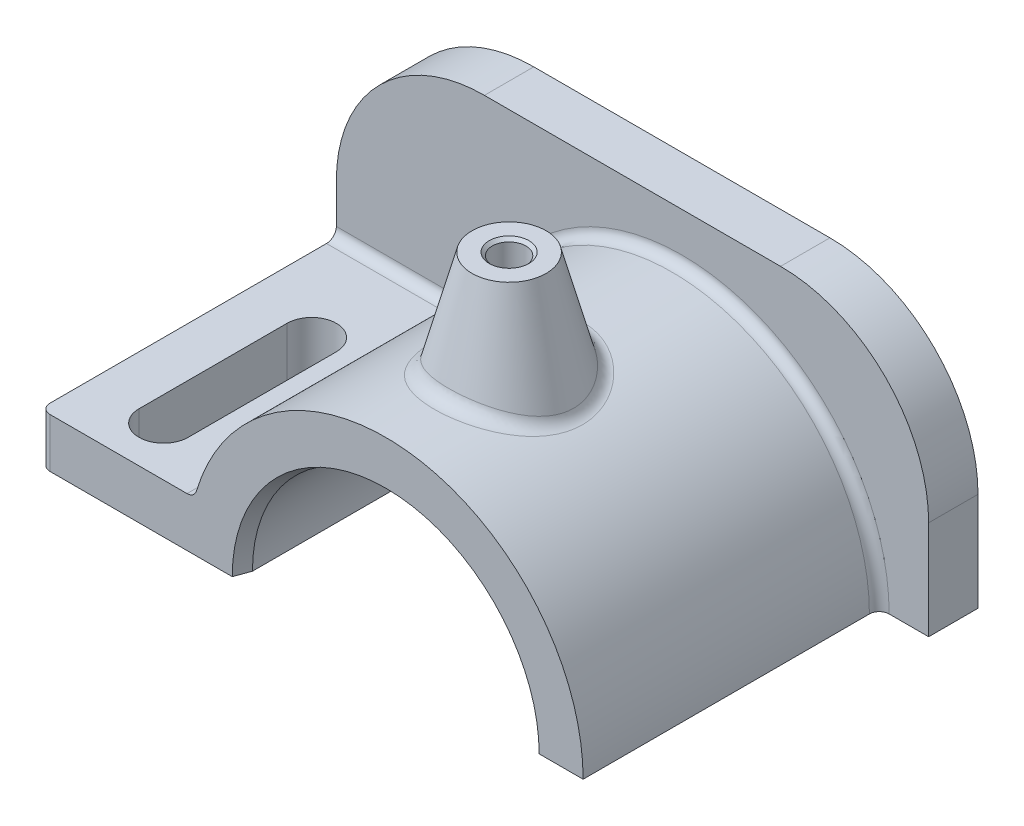
from build123d import *

# Parameters (mm, degrees)
P_IDAT_VYSUNUT_M1_DEPTH  = 60
ODEBRAT_VYSUNUT_M1_REACH = 130.841
P_IDAT_VYSUNUT_M2_DEPTH  = 10
M8_Z_VIT1_D              = 6.8
M8_Z_VIT1_CSINK_D        = 8.05
M8_Z_VIT1_CSINK_ANGLE    = 90
ZAOBLIT1_R               = 2
ZAOBLIT2_R               = 3
ZKOSEN_1_SIZE            = 3
ZKOSEN_1_SIZE2           = 1.091910703


# Read off the part's stored shape, not the designer's step: Přidat vysunutím3
with BuildPart() as part:
    # Skica1 → Přidat vysunutím1 (new body)
    with BuildSketch(Plane.XY):
        with BuildLine():
            Line((0, 0), (0, 10))
            Line((0, 10), (31.270166538, 10))
            ThreePointArc((31.270166538, 10), (75.040171699, 39.681187851), (110, 0))
            Line((110, 0), (100, 0))
            ThreePointArc((100, 0), (70, 30), (40, 0))
            Line((40, 0), (0, 0))
        make_face()
    extrude(amount=P_IDAT_VYSUNUT_M1_DEPTH)

    # Skica2 → Odebrat vysunutím1 (cut, up to next)
    with BuildSketch(Plane(origin=(0, 10, 0), x_dir=(1, 0, 0), z_dir=(0, 1, 0)), mode=Mode.PRIVATE) as odebrat_vysunut_m1_sk1:
        with BuildLine():
            Line((20, -20), (20, -50))
            ThreePointArc((20, -50), (15, -55), (10, -50))
            Line((10, -50), (10, -20))
            ThreePointArc((10, -20), (15, -15), (20, -20))
        make_face()
    odebrat_vysunut_m1_tool1 = extrude(odebrat_vysunut_m1_sk1.sketch, amount=-ODEBRAT_VYSUNUT_M1_REACH, mode=Mode.PRIVATE) & part.part
    add(odebrat_vysunut_m1_tool1.solids().sort_by_distance((15, 10, 35))[0], mode=Mode.SUBTRACT)

    # Skica3 → Přidat vysunutím2 (add)
    with BuildSketch(Plane(origin=(0, 0, 0), x_dir=(-1, 0, 0), z_dir=(0, 0, -1))):
        with BuildLine():
            Line((0, 0), (0, 20))
            ThreePointArc((0, 20), (-8.786796564, 41.213203436), (-30, 50))
            Line((-30, 50), (-90, 50))
            ThreePointArc((-90, 50), (-111.213203436, 41.213203436), (-120, 20))
            Line((-120, 20), (-120, 0))
            Line((-120, 0), (0, 0))
        make_face()
    extrude(amount=P_IDAT_VYSUNUT_M2_DEPTH)

    # Přidat vysunutím3 outline → Přidat vysunutím3 (revolve)
    with BuildSketch(Plane(origin=(70, 0, 35), x_dir=(1, 0, 0), z_dir=(0, 0, 1))):
        Polygon((7.5, 60), (0, 60), (0, 37.657552573), (13.486640745, 37.657552573), align=None)
    revolve(axis=Axis((70, 0, 35), (0, 1, 0)))

    # M8 závit1 (through all)
    with Locations(Plane(origin=(0, 60, 0), x_dir=(1, 0, 0), z_dir=(0, 1, 0))):
        with Locations((70, -35)):
            CounterSinkHole(M8_Z_VIT1_D / 2, M8_Z_VIT1_CSINK_D / 2, counter_sink_angle=M8_Z_VIT1_CSINK_ANGLE)

    # Zaoblit1
    zaoblit1_edges = [part.edges().sort_by_distance(p)[0] for p in [
        (31.270166538, 10, 30),
        (0, 5, 60),
        (15.635083269, 10, 0),
        (75.040171699, 39.681187851, 0),
    ]]
    fillet(zaoblit1_edges, radius=ZAOBLIT1_R)

    # Zaoblit2
    zaoblit2_edges = [part.edges().sort_by_distance(p)[0] for p in [
        (56.513435034, 37.657835378, 35.000000009),
        (70, 30, 0),
    ]]
    fillet(zaoblit2_edges, radius=ZAOBLIT2_R)

    # Zkosení1
    zkosen_1_edges = [part.edges().sort_by_distance(p)[0] for p in [
        (70, 30, 60),
    ]]
    zkosen_1_side = [part.faces().sort_by_distance(p)[0] for p in [
        (70, 30, 31.5),
    ]]
    chamfer(zkosen_1_edges, length=ZKOSEN_1_SIZE, length2=ZKOSEN_1_SIZE2, reference=zkosen_1_side[0])


solid = part.part
